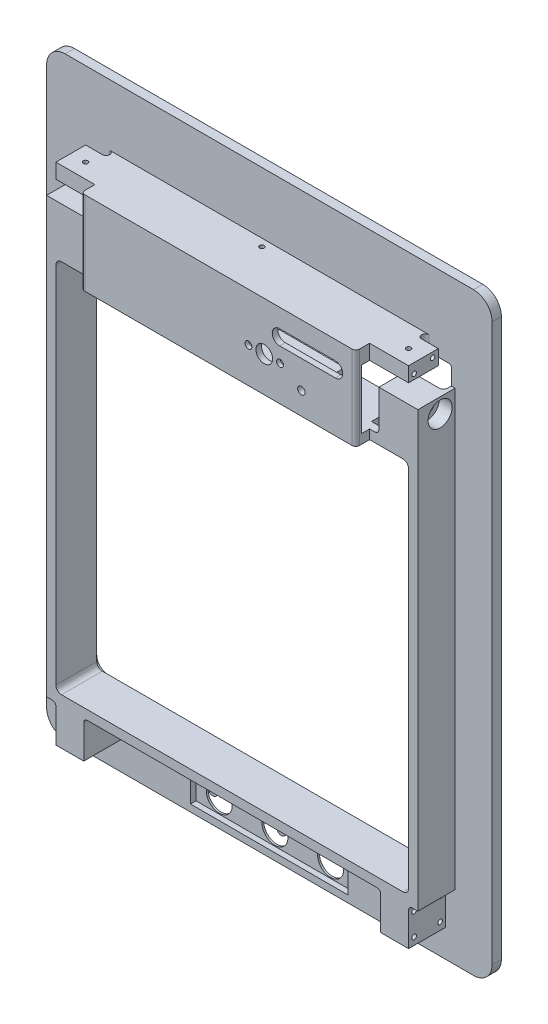
from build123d import *

# Parameters (mm, degrees)
SKETCH1_W               = 240
SKETCH1_H               = 320
BOSS_EXTRUDE1_DEPTH     = 5
FILLET1_R               = 10
SKETCH2_W               = 190
SKETCH2_H               = 202
CUT_EXTRUDE1_DEPTH      = 401.031248779
CUT_EXTRUDE3_DEPTH      = 3
SKETCH6_W               = 158
SKETCH6_H               = 32
CUT_EXTRUDE4_DEPTH      = 401.031248779
EXTRUDE_THIN1_DEPTH     = 20
SKETCH8_R               = 6.5
CUT_EXTRUDE5_DEPTH      = 2
SKETCH9_R               = 3.75
CUT_EXTRUDE6_DEPTH      = 3
CUT_EXTRUDE7_DEPTH      = 381.316973063
SKETCH11_W              = 196
SKETCH11_H              = 32
CUT_EXTRUDE8_DEPTH      = 12
SKETCH12_W              = 158
SKETCH12_H              = 5
BOSS_EXTRUDE2_DEPTH     = 22
SKETCH13_W              = 7
SKETCH13_H              = 5
CUT_EXTRUDE9_DEPTH      = 18
BOSS_EXTRUDE4_START     = 16
SKETCH15_R              = 6.5
BOSS_EXTRUDE4_DEPTH     = 16
BOSS_EXTRUDE5_DEPTH     = 2
BOSS_EXTRUDE6_DEPTH     = 16
BOSS_EXTRUDE7_DEPTH     = 2
SKETCH19_W              = 148
SKETCH19_H              = 7.45
BOSS_EXTRUDE8_DEPTH     = 5
SKETCH20_W              = 148
SKETCH20_H              = 3
BOSS_EXTRUDE9_DEPTH     = 40
SKETCH22_W              = 148
SKETCH22_H              = 5
BOSS_EXTRUDE10_DEPTH    = 4.45
SKETCH23_R              = 4.5
CUT_EXTRUDE10_DEPTH     = 3
SKETCH24_R              = 1.85
CUT_EXTRUDE11_DEPTH     = 4
SKETCH25_R              = 3.35
CUT_EXTRUDE12_DEPTH     = 1
BOSS_EXTRUDE12_DEPTH    = 3
CUT_EXTRUDE13_START     = -18
SKETCH29_R              = 6.5
CUT_EXTRUDE13_DEPTH     = 18
CUT_EXTRUDE14_START     = -13
SKETCH30_R              = 3.75
CUT_EXTRUDE14_DEPTH     = 13
FILLET4_R               = 3
M2_5_TAPPED_HOLE2_D     = 2.05
M2_5_TAPPED_HOLE2_DEPTH = 4
M2_5_TAPPED_HOLE2_TIP   = 0.615882135
CUT_EXTRUDE15_DEPTH     = 402.082662926
BOSS_EXTRUDE13_START    = 11
SKETCH35_R              = 6.5
SKETCH35_R_2            = 3.75
BOSS_EXTRUDE13_DEPTH    = 11
SKETCH36_R              = 6.5
SKETCH36_R_2            = 3.75
BOSS_EXTRUDE14_DEPTH    = 11
SKETCH37_W              = 15
SKETCH37_H              = 20
BOSS_EXTRUDE15_DEPTH    = 20
M3_TAPPED_HOLE1_D       = 2.5
M3_TAPPED_HOLE1_DEPTH   = 11.5
M3_TAPPED_HOLE1_TIP     = 0.751075774
M3_TAPPED_HOLE2_D       = 2.5
M3_TAPPED_HOLE2_DEPTH   = 11.5
M3_TAPPED_HOLE2_TIP     = 0.751075774
SKETCH42_R              = 2
CUT_EXTRUDE16_DEPTH     = 10
FILLET7_R               = 2
FILLET8_R               = 3
FILLET9_R               = 1
FILLET10_R              = 2
FILLET11_R              = 2
SKETCH43_W              = 16
SKETCH43_H              = 8
BOSS_EXTRUDE16_DEPTH    = 11
SKETCH44_W              = 16
SKETCH44_H              = 8
BOSS_EXTRUDE17_DEPTH    = 11
FILLET12_R              = 2
M3_TAPPED_HOLE3_D       = 2.5
M3_TAPPED_HOLE3_DEPTH   = 12
M3_TAPPED_HOLE3_TIP     = 0.751075774
M3_TAPPED_HOLE4_D       = 2.5
M3_TAPPED_HOLE4_DEPTH   = 12
M3_TAPPED_HOLE4_TIP     = 0.751075774
SKETCH49_R              = 2.5
BOSS_EXTRUDE18_DEPTH    = 12
SKETCH50_W              = 7.5
SKETCH50_H              = 6.5
SKETCH50_W_2            = 16
CUT_EXTRUDE17_DEPTH     = 401.940771811
FILLET13_R              = 1
M2_5_TAPPED_HOLE3_D     = 2.05
M2_5_TAPPED_HOLE3_DEPTH = 6.35
M2_5_TAPPED_HOLE3_TIP   = 0.615882135
SKETCH53_W              = 85
SKETCH53_H              = 20
CUT_EXTRUDE18_DEPTH     = 3
SKETCH54_W              = 5.8
SKETCH54_H              = 5.8
CUT_EXTRUDE19_DEPTH     = 402.157328862
FILLET14_R              = 1
SKETCH55_R              = 7
CUT_EXTRUDE20_DEPTH     = 402.157328862
FILLET15_R              = 1
CUT_EXTRUDE21_DEPTH     = 1
M3_TAPPED_HOLE5_D       = 2.5
M3_TAPPED_HOLE5_DEPTH   = 9.5
M3_TAPPED_HOLE5_TIP     = 0.751075774
M3_TAPPED_HOLE6_D       = 2.5
M3_TAPPED_HOLE6_DEPTH   = 7.5
M3_TAPPED_HOLE6_TIP     = 0.751075774


# Some blends are built 0.0001 mm under size
with BuildPart() as part:
    # Sketch1 → Boss-Extrude1 (new body)
    with BuildSketch(Plane.XY):
        with Locations((120, 160)):
            Rectangle(SKETCH1_W, SKETCH1_H)
    extrude(amount=BOSS_EXTRUDE1_DEPTH)

    # Fillet1
    fillet1_edges = [part.edges().sort_by_distance(p)[0] for p in [
        (0, 320, 2.5),
        (240, 320, 2.5),
        (240, 0, 2.5),
        (0, 0, 2.5),
    ]]
    fillet(fillet1_edges, radius=FILLET1_R)

    # Sketch2 → Cut-Extrude1 (cut, through all)
    with BuildSketch(Plane.XY.offset(5)):
        with Locations((120, 141)):
            Rectangle(SKETCH2_W, SKETCH2_H)
    extrude(amount=-CUT_EXTRUDE1_DEPTH, mode=Mode.SUBTRACT)

    # Sketch5 → Cut-Extrude3 (cut)
    with BuildSketch(Plane(origin=(0, 0, 0), x_dir=(-1, 0, 0), z_dir=(0, 0, -1))):
        with BuildLine():
            Line((-28, 274), (-212, 274))
            ThreePointArc((-212, 274), (-216.242640687, 272.242640687), (-218, 268))
            Line((-218, 268), (-218, 43))
            ThreePointArc((-218, 43), (-216.242640687, 38.757359313), (-212, 37))
            Line((-212, 37), (-28, 37))
            ThreePointArc((-28, 37), (-23.757359313, 38.757359313), (-22, 43))
            Line((-22, 43), (-22, 268))
            ThreePointArc((-22, 268), (-23.757359313, 272.242640687), (-28, 274))
        make_face()
    extrude(amount=-CUT_EXTRUDE3_DEPTH, mode=Mode.SUBTRACT)

    # Sketch6 → Cut-Extrude4 (cut, through all)
    with BuildSketch(Plane.XY.offset(5)):
        with Locations((120, 258)):
            Rectangle(SKETCH6_W, SKETCH6_H)
    extrude(amount=-CUT_EXTRUDE4_DEPTH, mode=Mode.SUBTRACT)

    # Sketch7 → Extrude-Thin1 (add)
    with BuildSketch(Plane.XY.offset(5)):
        Polygon((204, 247), (204, 287), (36, 287), (36, 247), (20, 247), (20, 35), (220, 35), (220, 247), align=None)
        Polygon((199, 242), (199, 282), (41, 282), (41, 242), (25, 242), (25, 40), (215, 40), (215, 242), align=None, mode=Mode.SUBTRACT)
    extrude(amount=EXTRUDE_THIN1_DEPTH)

    # Sketch8 → Cut-Extrude5 (cut)
    with BuildSketch(Plane(origin=(204, 0, 0), x_dir=(0, 0, -1), z_dir=(1, 0, 0))):
        with Locations((-13, 261)):
            Circle(SKETCH8_R)
    extrude(amount=-CUT_EXTRUDE5_DEPTH, mode=Mode.SUBTRACT)

    # Sketch9 → Cut-Extrude6 (cut)
    with BuildSketch(Plane(origin=(202, 0, 0), x_dir=(0, 0, -1), z_dir=(1, 0, 0))):
        with Locations((-13, 261)):
            Circle(SKETCH9_R)
    extrude(amount=-CUT_EXTRUDE6_DEPTH, mode=Mode.SUBTRACT)

    # Sketch10 → Cut-Extrude7 (cut, through all)
    with BuildSketch(Plane(origin=(204, 0, 0), x_dir=(0, 0, -1), z_dir=(1, 0, 0))):
        Polygon((-5, 264.5), (-9.2, 269), (-25, 269), (-25, 282), (-5, 282), align=None)
    extrude(amount=-CUT_EXTRUDE7_DEPTH, mode=Mode.SUBTRACT)

    # Sketch11 → Cut-Extrude8 (cut)
    with BuildSketch(Plane.XY.offset(5)):
        with Locations((120, 263)):
            Rectangle(SKETCH11_W, SKETCH11_H)
    extrude(amount=-CUT_EXTRUDE8_DEPTH, mode=Mode.SUBTRACT)

    # Sketch12 → Boss-Extrude2 (add)
    with BuildSketch(Plane.XY.offset(25)):
        with Locations((120, 244.5)):
            Rectangle(SKETCH12_W, SKETCH12_H)
    extrude(amount=-BOSS_EXTRUDE2_DEPTH)

    # Sketch13 → Cut-Extrude9 (cut)
    with BuildSketch(Plane(origin=(0, 0, 3), x_dir=(-1, 0, 0), z_dir=(0, 0, -1))):
        with Locations((-45.5, 244.5)):
            Rectangle(SKETCH13_W, SKETCH13_H)
        with Locations((-77.8, 244.5)):
            Rectangle(SKETCH13_W, SKETCH13_H)
        with Locations((-162.2, 244.5)):
            Rectangle(SKETCH13_W, SKETCH13_H)
        with Locations((-194.5, 244.5)):
            Rectangle(SKETCH13_W, SKETCH13_H)
    extrude(amount=-CUT_EXTRUDE9_DEPTH, mode=Mode.SUBTRACT)

    # Sketch15 → Boss-Extrude4 (add)
    with BuildSketch(Plane(origin=(204, 0, 0), x_dir=(0, 0, -1), z_dir=(1, 0, 0)).offset(BOSS_EXTRUDE4_START)):
        Polygon((-5, 247), (-5, 264.5), (-9.2, 269), (-25, 269), (-25, 247), align=None)
        with Locations((-13, 261)):
            Circle(SKETCH15_R, mode=Mode.SUBTRACT)
    extrude(amount=-BOSS_EXTRUDE4_DEPTH)

    # Sketch16 → Boss-Extrude5 (add)
    with BuildSketch(Plane(origin=(220, 0, 0), x_dir=(0, 0, -1), z_dir=(1, 0, 0))):
        Polygon((-5, 264.5), (-5, 269), (-9.2, 269), align=None)
    extrude(amount=-BOSS_EXTRUDE5_DEPTH)

    # Sketch17 → Boss-Extrude6 (add)
    with BuildSketch(Plane.ZY.offset(-36)):
        Polygon((25, 269), (9.2, 269), (5, 264.5), (5, 247), (25, 247), align=None)
    extrude(amount=BOSS_EXTRUDE6_DEPTH)

    # Sketch18 → Boss-Extrude7 (add)
    with BuildSketch(Plane.ZY.offset(-20)):
        Polygon((9.2, 269), (5, 269), (5, 264.5), align=None)
    extrude(amount=-BOSS_EXTRUDE7_DEPTH)

    # Sketch19 → Boss-Extrude8 (add)
    with BuildSketch(Plane.XZ.offset(-242)):
        with Locations((120, 28.725)):
            Rectangle(SKETCH19_W, SKETCH19_H)
    extrude(amount=-BOSS_EXTRUDE8_DEPTH)

    # Sketch20 → Boss-Extrude9 (add)
    with BuildSketch(Plane(origin=(0, 247, 0), x_dir=(1, 0, 0), z_dir=(0, 1, 0))):
        with Locations((120, -30.95)):
            Rectangle(SKETCH20_W, SKETCH20_H)
    extrude(amount=BOSS_EXTRUDE9_DEPTH)

    # Sketch22 → Boss-Extrude10 (add)
    with BuildSketch(Plane(origin=(0, 0, 29.45), x_dir=(-1, 0, 0), z_dir=(0, 0, -1))):
        with Locations((-120, 284.5)):
            Rectangle(SKETCH22_W, SKETCH22_H)
    extrude(amount=BOSS_EXTRUDE10_DEPTH)

    # Sketch23 → Cut-Extrude10 (cut)
    with BuildSketch(Plane.XY.offset(32.45)):
        with Locations((144.702326994, 261)):
            Circle(SKETCH23_R)
    extrude(amount=-CUT_EXTRUDE10_DEPTH, mode=Mode.SUBTRACT)

    # Sketch24 → Cut-Extrude11 (cut)
    with BuildSketch(Plane.XY.offset(32.45)):
        with Locations((136.202326994, 261)):
            Circle(SKETCH24_R)
        with Locations((153.202326994, 261)):
            Circle(SKETCH24_R)
    extrude(amount=-CUT_EXTRUDE11_DEPTH, mode=Mode.SUBTRACT)

    # Sketch25 → Cut-Extrude12 (cut)
    with BuildSketch(Plane(origin=(0, 0, 29.45), x_dir=(-1, 0, 0), z_dir=(0, 0, -1))):
        with Locations((-136.202326994, 261)):
            Circle(SKETCH25_R)
        with Locations((-153.202326994, 261)):
            Circle(SKETCH25_R)
    extrude(amount=-CUT_EXTRUDE12_DEPTH, mode=Mode.SUBTRACT)

    # Sketch28 → Boss-Extrude12 (add)
    with BuildSketch(Plane.XZ.offset(-282)):
        Polygon((204, 25), (194, 25), (194, 29.45), (46, 29.45), (46, 25), (36, 25), (36, 5), (204, 5), align=None)
    extrude(amount=BOSS_EXTRUDE12_DEPTH)

    # Sketch29 → Cut-Extrude13 (cut)
    with BuildSketch(Plane.ZY.offset(-20).offset(CUT_EXTRUDE13_START)):
        with Locations(Location((13, 261, 0), (0, 0, 180))):
            Circle(SKETCH29_R)
    extrude(amount=CUT_EXTRUDE13_DEPTH, mode=Mode.SUBTRACT)

    # Sketch30 → Cut-Extrude14 (cut)
    with BuildSketch(Plane.ZY.offset(-38).offset(CUT_EXTRUDE14_START)):
        with Locations(Location((13, 261, 0), (0, 0, 180))):
            Circle(SKETCH30_R)
    extrude(amount=CUT_EXTRUDE14_DEPTH, mode=Mode.SUBTRACT)

    # Fillet4
    fillet4_edges = [part.edges().sort_by_distance(p)[0] for p in [
        (215, 242, 14),
        (25, 242, 14),
    ]]
    fillet(fillet4_edges, radius=FILLET4_R)

    # M2.5 Tapped Hole2
    with Locations(Plane(origin=(31.062553001, 282, 5), x_dir=(1, 0, 0), z_dir=(0, 0, 1))):
        with Locations((0, 0), (177.874893998, 0)):
            Hole(M2_5_TAPPED_HOLE2_D / 2, depth=M2_5_TAPPED_HOLE2_DEPTH)
            with Locations((0, 0, -(M2_5_TAPPED_HOLE2_DEPTH + M2_5_TAPPED_HOLE2_TIP / 2))):  # 118° drill point
                Cone(0, M2_5_TAPPED_HOLE2_D / 2, M2_5_TAPPED_HOLE2_TIP, mode=Mode.SUBTRACT)

    # Sketch34 → Cut-Extrude15 (cut, through all)
    with BuildSketch(Plane(origin=(0, 0, 29.45), x_dir=(-1, 0, 0), z_dir=(0, 0, -1))):
        with BuildLine():
            Line((-183, 277), (-153, 277))
            ThreePointArc((-153, 277), (-149, 273), (-153, 269))
            Line((-153, 269), (-183, 269))
            ThreePointArc((-183, 269), (-187, 273), (-183, 277))
        make_face()
    extrude(amount=-CUT_EXTRUDE15_DEPTH, mode=Mode.SUBTRACT)

    # Sketch35 → Boss-Extrude13 (add)
    with BuildSketch(Plane(origin=(202, 0, 0), x_dir=(0, 0, -1), z_dir=(1, 0, 0)).offset(BOSS_EXTRUDE13_START)):
        with Locations(Location((-13, 261, 0), (0, 0, 270))):
            Circle(SKETCH35_R)
        with Locations((-13, 261)):
            Circle(SKETCH35_R_2, mode=Mode.SUBTRACT)
    extrude(amount=-BOSS_EXTRUDE13_DEPTH)

    # Sketch36 → Boss-Extrude14 (add)
    with BuildSketch(Plane.ZY.offset(-38)):
        with Locations(Location((13, 261, 0), (0, 0, 270))):
            Circle(SKETCH36_R)
        with Locations(Location((13, 261, 0), (0, 0, 180))):
            Circle(SKETCH36_R_2, mode=Mode.SUBTRACT)
    extrude(amount=BOSS_EXTRUDE14_DEPTH)

    # Sketch37 → Boss-Extrude15 (add)
    with BuildSketch(Plane.XY.offset(5)):
        with Locations((207.5, 25)):
            Rectangle(SKETCH37_W, SKETCH37_H)
        with Locations((32.5, 25)):
            Rectangle(SKETCH37_W, SKETCH37_H)
    extrude(amount=BOSS_EXTRUDE15_DEPTH)

    # M3 Tapped Hole1
    with Locations(Plane(origin=(25, 19, 8), x_dir=(0, 0, -1), z_dir=(-1, 0, 0))):
        with Locations((0, 0), (0, -12), (-14, 0), (-14, -12)):
            Hole(M3_TAPPED_HOLE1_D / 2, depth=M3_TAPPED_HOLE1_DEPTH)
            with Locations((0, 0, -(M3_TAPPED_HOLE1_DEPTH + M3_TAPPED_HOLE1_TIP / 2))):  # 118° drill point
                Cone(0, M3_TAPPED_HOLE1_D / 2, M3_TAPPED_HOLE1_TIP, mode=Mode.SUBTRACT)

    # M3 Tapped Hole2
    with Locations(Plane(origin=(215, 31, 8), x_dir=(0, 0, 1), z_dir=(1, 0, 0))):
        with Locations((0, 0), (0, 12), (14, 12), (14, 0)):
            Hole(M3_TAPPED_HOLE2_D / 2, depth=M3_TAPPED_HOLE2_DEPTH)
            with Locations((0, 0, -(M3_TAPPED_HOLE2_DEPTH + M3_TAPPED_HOLE2_TIP / 2))):  # 118° drill point
                Cone(0, M3_TAPPED_HOLE2_D / 2, M3_TAPPED_HOLE2_TIP, mode=Mode.SUBTRACT)

    # Sketch42 → Cut-Extrude16 (cut)
    with BuildSketch(Plane(origin=(0, 0, 29.45), x_dir=(-1, 0, 0), z_dir=(0, 0, -1))):
        with Locations((-164.7, 254)):
            Circle(SKETCH42_R)
    extrude(amount=-CUT_EXTRUDE16_DEPTH, mode=Mode.SUBTRACT)

    # Fillet7
    fillet7_edges = [part.edges().sort_by_distance(p)[0] for p in [
        (215, 35, 15),
        (200, 35, 15),
        (25, 35, 15),
        (40, 35, 15),
    ]]
    fillet(fillet7_edges, radius=FILLET7_R)

    # Fillet8
    fillet8_edges = [part.edges().sort_by_distance(p)[0] for p in [
        (215, 40, 14),
        (25, 40, 14),
    ]]
    fillet(fillet8_edges, radius=FILLET8_R)

    # Fillet9
    fillet9_edges = [part.edges().sort_by_distance(p)[0] for p in [
        (218, 279, 2.5),
        (218, 247, 4),
        (22, 247, 4),
        (22, 279, 2.5),
    ]]
    fillet(fillet9_edges, radius=FILLET9_R)

    # Fillet10
    # the kernel refuses this fillet: 2 mm, written as the material it adds along each edge
    with BuildSketch(Plane(origin=(41, 247, 25), x_dir=(1, 0, 0), z_dir=(0, 0, -1))) as fillet10_piece_1_section:
        with BuildLine():
            CenterArc((FILLET10_R, -FILLET10_R), FILLET10_R, 90, 90)
            Line((0, -FILLET10_R), (0, 0))
            Line((0, 0), (FILLET10_R, 0))
        make_face()
    fillet10_piece_1 = extrude(amount=20, mode=Mode.PRIVATE)
    fillet10_piece_1 = split(fillet10_piece_1, bisect_by=Plane(origin=(42, 247.048016763, 23), z_dir=(1, 0, 0)), keep=Keep.TOP, mode=Mode.PRIVATE)
    fillet10_piece_1 = split(fillet10_piece_1, bisect_by=Plane(origin=(42.326501569, 247.048016763, 21), z_dir=(0, 0, 1)), keep=Keep.TOP, mode=Mode.PRIVATE)
    add(fillet10_piece_1)
    with BuildSketch(Plane(origin=(41, 247, 25), x_dir=(1, 0, 0), z_dir=(0, 0, -1))) as fillet10_piece_2_section:
        with BuildLine():
            CenterArc((FILLET10_R, -FILLET10_R), FILLET10_R, 90, 90)
            Line((0, -FILLET10_R), (0, 0))
            Line((0, 0), (FILLET10_R, 0))
        make_face()
    fillet10_piece_2 = extrude(amount=20, mode=Mode.PRIVATE)
    fillet10_piece_2 = split(fillet10_piece_2, bisect_by=Plane(origin=(42, 247.51024012, 23), z_dir=(-1, 0, 0)), keep=Keep.TOP, mode=Mode.PRIVATE)
    fillet10_piece_2 = split(fillet10_piece_2, bisect_by=Plane(origin=(41.328783529, 247.51024012, 21), z_dir=(0, 0, 1)), keep=Keep.TOP, mode=Mode.PRIVATE)
    add(fillet10_piece_2)
    with BuildSketch(Plane(origin=(41, 247, 25), x_dir=(1, 0, 0), z_dir=(0, 0, -1))) as fillet10_piece_3_section:
        with BuildLine():
            CenterArc((FILLET10_R, -FILLET10_R), FILLET10_R, 90, 90)
            Line((0, -FILLET10_R), (0, 0))
            Line((0, 0), (FILLET10_R, 0))
        make_face()
    fillet10_piece_3 = extrude(amount=20, mode=Mode.PRIVATE)
    fillet10_piece_3 = split(fillet10_piece_3, bisect_by=Plane(origin=(42, 247.51024012, 13), z_dir=(-1, 0, 0)), keep=Keep.TOP, mode=Mode.PRIVATE)
    fillet10_piece_3 = split(fillet10_piece_3, bisect_by=Plane(origin=(41.328783529, 247.51024012, 21), z_dir=(0, 0, -1)), keep=Keep.TOP, mode=Mode.PRIVATE)
    add(fillet10_piece_3)
    with BuildSketch(Plane(origin=(199, 247, 25), x_dir=(-1, 0, 0), z_dir=(0, 0, -1))) as fillet10_piece_4_section:
        with BuildLine():
            CenterArc((FILLET10_R, FILLET10_R), FILLET10_R, 180, 90)
            Line((0, FILLET10_R), (0, 0))
            Line((0, 0), (FILLET10_R, 0))
        make_face()
    fillet10_piece_4 = extrude(amount=20, mode=Mode.PRIVATE)
    fillet10_piece_4 = split(fillet10_piece_4, bisect_by=Plane(origin=(198, 247.048016763, 23), z_dir=(-1, 0, 0)), keep=Keep.TOP, mode=Mode.PRIVATE)
    fillet10_piece_4 = split(fillet10_piece_4, bisect_by=Plane(origin=(197.673498431, 247.048016763, 21), z_dir=(0, 0, 1)), keep=Keep.TOP, mode=Mode.PRIVATE)
    add(fillet10_piece_4)
    with BuildSketch(Plane(origin=(199, 247, 25), x_dir=(-1, 0, 0), z_dir=(0, 0, -1))) as fillet10_piece_5_section:
        with BuildLine():
            CenterArc((FILLET10_R, FILLET10_R), FILLET10_R, 180, 90)
            Line((0, FILLET10_R), (0, 0))
            Line((0, 0), (FILLET10_R, 0))
        make_face()
    fillet10_piece_5 = extrude(amount=20, mode=Mode.PRIVATE)
    fillet10_piece_5 = split(fillet10_piece_5, bisect_by=Plane(origin=(198, 247.51024012, 23), z_dir=(1, 0, 0)), keep=Keep.TOP, mode=Mode.PRIVATE)
    fillet10_piece_5 = split(fillet10_piece_5, bisect_by=Plane(origin=(198.671216471, 247.51024012, 21), z_dir=(0, 0, 1)), keep=Keep.TOP, mode=Mode.PRIVATE)
    add(fillet10_piece_5)
    with BuildSketch(Plane(origin=(199, 247, 25), x_dir=(-1, 0, 0), z_dir=(0, 0, -1))) as fillet10_piece_6_section:
        with BuildLine():
            CenterArc((FILLET10_R, FILLET10_R), FILLET10_R, 180, 90)
            Line((0, FILLET10_R), (0, 0))
            Line((0, 0), (FILLET10_R, 0))
        make_face()
    fillet10_piece_6 = extrude(amount=20, mode=Mode.PRIVATE)
    fillet10_piece_6 = split(fillet10_piece_6, bisect_by=Plane(origin=(198, 247.51024012, 13), z_dir=(1, 0, 0)), keep=Keep.TOP, mode=Mode.PRIVATE)
    fillet10_piece_6 = split(fillet10_piece_6, bisect_by=Plane(origin=(198.671216471, 247.51024012, 21), z_dir=(0, 0, -1)), keep=Keep.TOP, mode=Mode.PRIVATE)
    add(fillet10_piece_6)
    with BuildSketch(Plane(origin=(218, 272.655276341, 12.611591252), x_dir=(-1, 0, 0), z_dir=(0, -0.7310552682428735, -0.6823182503600065))) as fillet10_piece_7_section:
        with BuildLine():
            CenterArc((FILLET10_R, FILLET10_R), FILLET10_R, 180, 90)
            Line((0, FILLET10_R), (0, 0))
            Line((0, 0), (FILLET10_R, 0))
        make_face()
    fillet10_piece_7 = extrude(amount=16.155485359, mode=Mode.PRIVATE)
    fillet10_piece_7 = split(fillet10_piece_7, bisect_by=Plane(origin=(217.505253367, 269, 6.838891417), z_dir=(0, -1, 0)), keep=Keep.TOP, mode=Mode.PRIVATE)
    fillet10_piece_7 = split(fillet10_piece_7, bisect_by=Plane(origin=(217.505253367, 267.029759196, 5), z_dir=(0, 0, 1)), keep=Keep.TOP, mode=Mode.PRIVATE)
    add(fillet10_piece_7)
    with BuildSketch(Plane(origin=(22, 260.844723659, 1.588408748), x_dir=(1, 0, 0), z_dir=(0, 0.7310552682428716, 0.6823182503600084))) as fillet10_piece_8_section:
        with BuildLine():
            CenterArc((FILLET10_R, FILLET10_R), FILLET10_R, 180, 90)
            Line((0, FILLET10_R), (0, 0))
            Line((0, 0), (FILLET10_R, 0))
        make_face()
    fillet10_piece_8 = extrude(amount=16.155485359, mode=Mode.PRIVATE)
    fillet10_piece_8 = split(fillet10_piece_8, bisect_by=Plane(origin=(22.494746633, 269, 6.838891417), z_dir=(0, -1, 0)), keep=Keep.TOP, mode=Mode.PRIVATE)
    fillet10_piece_8 = split(fillet10_piece_8, bisect_by=Plane(origin=(22.494746633, 267.029759196, 5), z_dir=(0, 0, 1)), keep=Keep.TOP, mode=Mode.PRIVATE)
    add(fillet10_piece_8)

    # Fillet11
    fillet11_edges = [part.edges().sort_by_distance(p)[0] for p in [
        (46, 264.5, 32.45),
        (194, 264.5, 32.45),
    ]]
    fillet(fillet11_edges, radius=FILLET11_R)

    # Sketch43 → Boss-Extrude16 (add)
    with BuildSketch(Plane.ZY.offset(-36)):
        with Locations((17, 283)):
            Rectangle(SKETCH43_W, SKETCH43_H)
    extrude(amount=BOSS_EXTRUDE16_DEPTH)

    # Sketch44 → Boss-Extrude17 (add)
    with BuildSketch(Plane(origin=(204, 0, 0), x_dir=(0, 0, -1), z_dir=(1, 0, 0))):
        with Locations((-17, 283)):
            Rectangle(SKETCH44_W, SKETCH44_H)
    extrude(amount=BOSS_EXTRUDE17_DEPTH)

    # Fillet12
    fillet12_edges = [part.edges().sort_by_distance(p)[0] for p in [
        (204, 283, 9),
        (204, 283, 5),
        (36, 283, 9),
        (36, 283, 5),
    ]]
    fillet(fillet12_edges, radius=FILLET12_R - 0.0001)  # a hair under: the kernel refuses the full size

    # M3 Tapped Hole3
    with Locations(Plane(origin=(215, 284.25, 12), x_dir=(0, 0, 1), z_dir=(1, 0, 0))):
        with Locations((0, 0), (10, 2.5)):
            Hole(M3_TAPPED_HOLE3_D / 2, depth=M3_TAPPED_HOLE3_DEPTH)
            with Locations((0, 0, -(M3_TAPPED_HOLE3_DEPTH + M3_TAPPED_HOLE3_TIP / 2))):  # 118° drill point
                Cone(0, M3_TAPPED_HOLE3_D / 2, M3_TAPPED_HOLE3_TIP, mode=Mode.SUBTRACT)

    # M3 Tapped Hole4
    with Locations(Plane(origin=(25, 284.25, 12), x_dir=(0, 0, -1), z_dir=(-1, 0, 0))):
        with Locations((0, 0), (-10, 2.5)):
            Hole(M3_TAPPED_HOLE4_D / 2, depth=M3_TAPPED_HOLE4_DEPTH)
            with Locations((0, 0, -(M3_TAPPED_HOLE4_DEPTH + M3_TAPPED_HOLE4_TIP / 2))):  # 118° drill point
                Cone(0, M3_TAPPED_HOLE4_D / 2, M3_TAPPED_HOLE4_TIP, mode=Mode.SUBTRACT)

    # Sketch49 → Boss-Extrude18 (add)
    with BuildSketch(Plane.XY.offset(5)):
        with Locations(Location((138.5, 28, 0), (0, 0, 180))):
            Circle(SKETCH49_R)
        with Locations(Location((101.5, 28, 0), (0, 0, 180))):
            Circle(SKETCH49_R)
    extrude(amount=BOSS_EXTRUDE18_DEPTH)

    # Sketch50 → Cut-Extrude17 (cut, through all)
    with BuildSketch(Plane.XY.offset(5)):
        with Locations((130, 28)):
            Rectangle(SKETCH50_W, SKETCH50_H)
        with Locations((114.25, 28)):
            Rectangle(SKETCH50_W_2, SKETCH50_H)
    extrude(amount=-CUT_EXTRUDE17_DEPTH, mode=Mode.SUBTRACT)

    # Fillet13
    fillet13_edges = [part.edges().sort_by_distance(p)[0] for p in [
        (133.75, 31.25, 2.5),
        (133.75, 24.75, 2.5),
        (126.25, 24.75, 2.5),
        (126.25, 31.25, 2.5),
        (122.25, 31.25, 2.5),
        (122.25, 24.75, 2.5),
        (106.25, 24.75, 2.5),
        (106.25, 31.25, 2.5),
    ]]
    fillet(fillet13_edges, radius=FILLET13_R)

    # M2.5 Tapped Hole3
    with Locations(Plane(origin=(138.5, 28, 17), x_dir=(1, 0, 0), z_dir=(0, 0, 1))):
        with Locations((0, 0), (-37, 0)):
            Hole(M2_5_TAPPED_HOLE3_D / 2, depth=M2_5_TAPPED_HOLE3_DEPTH)
            with Locations((0, 0, -(M2_5_TAPPED_HOLE3_DEPTH + M2_5_TAPPED_HOLE3_TIP / 2))):  # 118° drill point
                Cone(0, M2_5_TAPPED_HOLE3_D / 2, M2_5_TAPPED_HOLE3_TIP, mode=Mode.SUBTRACT)

    # Sketch53 → Cut-Extrude18 (cut)
    with BuildSketch(Plane.XY.offset(5)):
        with Locations((120, 13.75)):
            Rectangle(SKETCH53_W, SKETCH53_H)
    extrude(amount=-CUT_EXTRUDE18_DEPTH, mode=Mode.SUBTRACT)

    # Sketch54 → Cut-Extrude19 (cut, through all)
    with BuildSketch(Plane.XY.offset(2)):
        with Locations((120, 20.35)):
            Rectangle(SKETCH54_W, SKETCH54_H)
    extrude(amount=-CUT_EXTRUDE19_DEPTH, mode=Mode.SUBTRACT)

    # Fillet14
    fillet14_edges = [part.edges().sort_by_distance(p)[0] for p in [
        (122.9, 23.25, 1),
        (117.1, 23.25, 1),
    ]]
    fillet(fillet14_edges, radius=FILLET14_R)

    # Sketch55 → Cut-Extrude20 (cut, through all)
    with BuildSketch(Plane.XY.offset(2)):
        with Locations((150, 11.25)):
            Circle(SKETCH55_R)
        with Locations((120, 11.25)):
            Circle(SKETCH55_R)
        with Locations((90, 11.25)):
            Circle(SKETCH55_R)
    extrude(amount=-CUT_EXTRUDE20_DEPTH, mode=Mode.SUBTRACT)

    # Fillet15
    fillet15_edges = [part.edges().sort_by_distance(p)[0] for p in [
        (122.9, 17.621028174, 1),
        (117.1, 17.621028174, 1),
    ]]
    fillet(fillet15_edges, radius=FILLET15_R)

    # Sketch56 → Cut-Extrude21 (cut)
    with BuildSketch(Plane(origin=(0, 0, 0), x_dir=(-1, 0, 0), z_dir=(0, 0, -1))):
        with BuildLine():
            Line((-160, 34), (-80, 34))
            ThreePointArc((-80, 34), (-64.5, 18.5), (-80, 3))
            Line((-80, 3), (-160, 3))
            ThreePointArc((-160, 3), (-175.5, 18.5), (-160, 34))
        make_face()
    extrude(amount=-CUT_EXTRUDE21_DEPTH, mode=Mode.SUBTRACT)

    # M3 Tapped Hole5
    with Locations(Plane(origin=(33, 287, 17), x_dir=(0, 0, 1), z_dir=(0, 1, 0))):
        with Locations((0, 0), (-8, 87), (0, 174)):
            Hole(M3_TAPPED_HOLE5_D / 2, depth=M3_TAPPED_HOLE5_DEPTH)
            with Locations((0, 0, -(M3_TAPPED_HOLE5_DEPTH + M3_TAPPED_HOLE5_TIP / 2))):  # 118° drill point
                Cone(0, M3_TAPPED_HOLE5_D / 2, M3_TAPPED_HOLE5_TIP, mode=Mode.SUBTRACT)

    # M3 Tapped Hole6
    with Locations(Plane(origin=(207.5, 15, 15), x_dir=(-1, 0, 0), z_dir=(0, -1, 0))):
        with Locations((0, 0), (175, 0)):
            Hole(M3_TAPPED_HOLE6_D / 2, depth=M3_TAPPED_HOLE6_DEPTH)
            with Locations((0, 0, -(M3_TAPPED_HOLE6_DEPTH + M3_TAPPED_HOLE6_TIP / 2))):  # 118° drill point
                Cone(0, M3_TAPPED_HOLE6_D / 2, M3_TAPPED_HOLE6_TIP, mode=Mode.SUBTRACT)


solid = part.part
